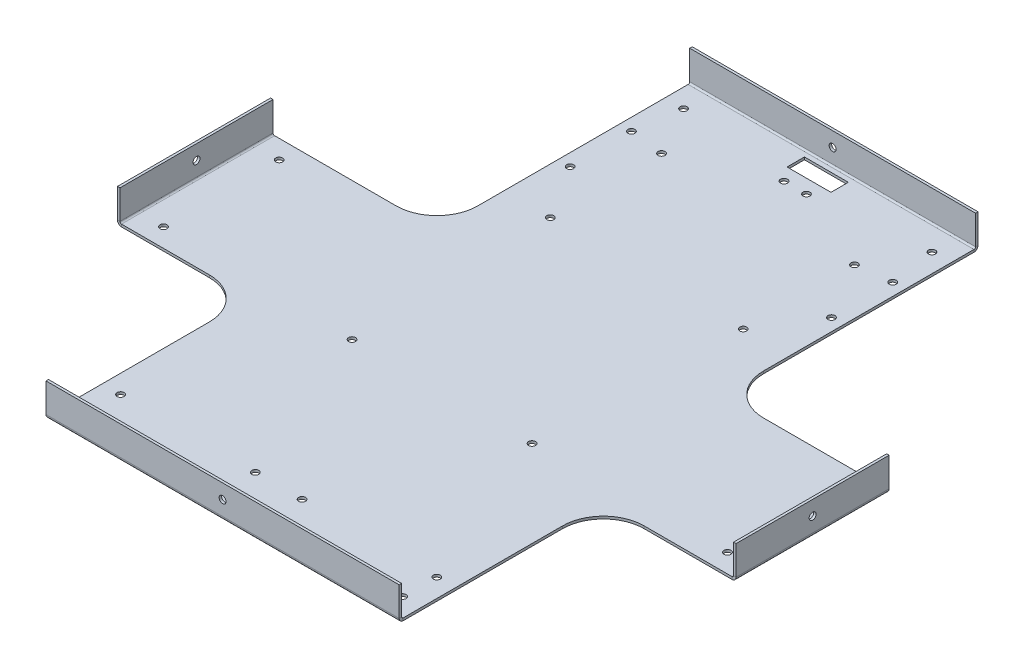
from build123d import *

# Parameters (mm, degrees)
BASE_FLANGE1_DEPTH            = 1.21
M3_CLEARANCE_HOLE2_AT_2_COUNT = 2
M3_CLEARANCE_HOLE2_AT_2_PITCH = 66
M3_CLEARANCE_HOLE2_AT_3_COUNT = 2
M3_CLEARANCE_HOLE2_AT_3_PITCH = 86.678897774
FILLET1_R                     = 20
SKETCH62_W                    = 21.5
SKETCH62_H                    = 8.5
QRD_CLEARANCE_DEPTH           = 10
QRD_HOLES_D                   = 3.4
QRD_HOLES_DEPTH               = 1.27
QRD_HOLES_TIP                 = 1.021463052
M3_STEERING_BOX_D             = 3.4
M3_STEERING_BOX_DEPTH         = 3
M3_STEERING_BOX_TIP           = 1.021463052
EDGE_FLANGE1_STRIP_W          = 6.364
EDGE_FLANGE1_STRIP_H          = 1.21
EDGE_FLANGE1_STRIP_CUT_DEPTH  = 173
EDGE_FLANGE1_DEPTH            = 173
EDGE_FLANGE2_STRIP_W          = 6.364
EDGE_FLANGE2_STRIP_H          = 1.21
EDGE_FLANGE2_STRIP_CUT_DEPTH  = 140
EDGE_FLANGE2_DEPTH            = 140
EDGE_FLANGE3_STRIP_W          = 6.364
EDGE_FLANGE3_STRIP_H          = 1.21
EDGE_FLANGE3_STRIP_CUT_DEPTH  = 75
EDGE_FLANGE3_DEPTH            = 75
M3_CLEARANCE_HOLE3_D          = 3.4
M3_CLEARANCE_HOLE4_D          = 3.4
M3_CLEARANCE_HOLE5_D          = 3.4
M3_CLEARANCE_HOLE5_DEPTH      = 1.21
M3_CLEARANCE_HOLE6_D          = 3.4
M3_CLEARANCE_HOLE7_D          = 3.4
M3_CLEARANCE_HOLE7_DEPTH      = 1.21
M3_CLEARANCE_HOLE7_TIP        = 1.021463052
M3_CLEARANCE_HOLE8_D          = 3.4
M3_CLEARANCE_HOLE9_D          = 3.4
M3_CLEARANCE_HOLE10_D         = 3.4
M3_CLEARANCE_HOLE11_D         = 3.4


# Sheet-metal steps are written as plain solids
with BuildPart() as part:
    # Sketch1 → Base-Flange1 (new body)
    with BuildSketch(Plane(origin=(0, 0, 0), x_dir=(1, 0, 0), z_dir=(0, 1, 0))):
        Polygon((0, 0), (173, 0), (173, 100), (238, 100), (238, 175), (156.5, 175), (156.5, 300), (16.5, 300), (16.5, 175), (-65, 175), (-65, 100), (0, 100), align=None)
    extrude(amount=-BASE_FLANGE1_DEPTH)

    # Sketch28 → M3 Clearance Hole2 (revolve, cut)
    with BuildSketch(Plane(origin=(9.052, -1.21, -27.479586063), x_dir=(0, 0, -1), z_dir=(1, 0, 0))):
        Polygon((0, 0), (0, 2.291463052), (1.7, 1.27), (1.7, 0), align=None)
    m3_clearance_hole2 = revolve(axis=Axis((9.052, -7.56, -27.479586063), (0, 1, 0)), mode=Mode.SUBTRACT)

    # M3 Clearance Hole2 at 2: M3 Clearance Hole2 ×2
    with Locations(*[(i * M3_CLEARANCE_HOLE2_AT_2_PITCH, 0, 0) for i in range(1, M3_CLEARANCE_HOLE2_AT_2_COUNT)]):
        add(m3_clearance_hole2, mode=Mode.SUBTRACT)

    # M3 Clearance Hole2 at 3: M3 Clearance Hole2 ×2
    with Locations(*[Vector(0.38492784467456836, 0, -0.9229466693120418) * (i * M3_CLEARANCE_HOLE2_AT_3_PITCH) for i in range(1, M3_CLEARANCE_HOLE2_AT_3_COUNT)]):
        add(m3_clearance_hole2, mode=Mode.SUBTRACT)

    # Mirror3: M3 Clearance Hole2 across plane
    add(m3_clearance_hole2.mirror(Plane(origin=(86.5, 0, 0), x_dir=(0, 0, 1), z_dir=(1, 0, 0))), mode=Mode.SUBTRACT)

    # Mirror3 copy 1 sketch → Mirror3 copy 1 (revolve, cut)
    with BuildSketch(Plane(origin=(97.948, -1.21, -27.479586063), x_dir=(0, 0, -1), z_dir=(-1, 0, 0))):
        Polygon((0, 0), (0, -2.291463052), (1.7, -1.27), (1.7, 0), align=None)
    revolve(axis=Axis((97.948, -7.56, -27.479586063), (0, -1, 0)), mode=Mode.SUBTRACT)

    # Mirror3 copy 2 sketch → Mirror3 copy 2 (revolve, cut)
    with BuildSketch(Plane(origin=(130.582878701, -1.21, -107.479586063), x_dir=(0, 0, -1), z_dir=(-1, 0, 0))):
        Polygon((0, 0), (0, -2.291463052), (1.7, -1.27), (1.7, 0), align=None)
    revolve(axis=Axis((130.582878701, -7.56, -107.479586063), (0, -1, 0)), mode=Mode.SUBTRACT)

    # Fillet1
    fillet1_edges = [part.edges().sort_by_distance(p)[0] for p in [
        (0, -0.605, -100),
        (16.5, -0.605, -175),
        (156.5, -0.605, -175),
        (173, -0.605, -100),
    ]]
    fillet(fillet1_edges, radius=FILLET1_R)

    # Sketch62 → QRD Clearance (cut)
    with BuildSketch(Plane(origin=(0, 0, 0), x_dir=(1, 0, 0), z_dir=(0, 1, 0))):
        with Locations((86.5, 291.488)):
            Rectangle(SKETCH62_W, SKETCH62_H)
    extrude(amount=-QRD_CLEARANCE_DEPTH, mode=Mode.SUBTRACT)

    # QRD Holes
    with Locations(Plane(origin=(0, 0, 0), x_dir=(1, 0, 0), z_dir=(0, 1, 0))):
        with Locations((92, 280.488), (81, 280.488)):
            Hole(QRD_HOLES_D / 2, depth=QRD_HOLES_DEPTH)
            with Locations((0, 0, -(QRD_HOLES_DEPTH + QRD_HOLES_TIP / 2))):  # 118° drill point
                Cone(0, QRD_HOLES_D / 2, QRD_HOLES_TIP, mode=Mode.SUBTRACT)

    # M3 (Steering Box)
    with Locations(Plane(origin=(0, 0, 0), x_dir=(1, 0, 0), z_dir=(0, 1, 0))):
        with Locations((39.262, 262.238), (39.262, 207.762), (133.738, 207.762), (133.738, 262.238)):
            Hole(M3_STEERING_BOX_D / 2, depth=M3_STEERING_BOX_DEPTH)
            with Locations((0, 0, -(M3_STEERING_BOX_DEPTH + M3_STEERING_BOX_TIP / 2))):  # 118° drill point
                Cone(0, M3_STEERING_BOX_D / 2, M3_STEERING_BOX_TIP, mode=Mode.SUBTRACT)

    # Edge-Flange1 strip (across the edge) → Edge-Flange1 strip cut (cut)
    with BuildSketch(Plane(origin=(0, 0, 0), x_dir=(0, 0, -1), z_dir=(1, 0, 0))):
        with Locations((-1.21, -0.605)):
            Rectangle(EDGE_FLANGE1_STRIP_W, EDGE_FLANGE1_STRIP_H)
    extrude(amount=EDGE_FLANGE1_STRIP_CUT_DEPTH, mode=Mode.SUBTRACT)

    # Edge-Flange1 section (across the edge) → Edge-Flange1 (add)
    with BuildSketch(Plane(origin=(0, 0, 0), x_dir=(0, 0, -1), z_dir=(1, 0, 0))):
        with BuildLine():
            Line((0, 0.762), (0, 15))
            Line((0, 15), (1.21, 15))
            Line((1.21, 15), (1.21, 0.762))
            ThreePointArc((1.21, 0.762), (1.433184633, 0.223184633), (1.972, 0))
            Line((1.972, 0), (1.972, -1.21))
            ThreePointArc((1.972, -1.21), (0.577585428, -0.632414572), (0, 0.762))
        make_face()
    extrude(amount=EDGE_FLANGE1_DEPTH)

    # Edge-Flange2 strip (across the edge) → Edge-Flange2 strip cut (cut)
    with BuildSketch(Plane(origin=(156.5, 0, -300), x_dir=(0, 0, 1), z_dir=(-1, 0, 0))):
        with Locations((-1.21, -0.605)):
            Rectangle(EDGE_FLANGE2_STRIP_W, EDGE_FLANGE2_STRIP_H)
    extrude(amount=EDGE_FLANGE2_STRIP_CUT_DEPTH, mode=Mode.SUBTRACT)

    # Edge-Flange2 section (across the edge) → Edge-Flange2 (add)
    with BuildSketch(Plane(origin=(156.5, 0, -300), x_dir=(0, 0, 1), z_dir=(-1, 0, 0))):
        with BuildLine():
            Line((0, 0.762), (0, 15))
            Line((0, 15), (1.21, 15))
            Line((1.21, 15), (1.21, 0.762))
            ThreePointArc((1.21, 0.762), (1.433184633, 0.223184633), (1.972, 0))
            Line((1.972, 0), (1.972, -1.21))
            ThreePointArc((1.972, -1.21), (0.577585428, -0.632414572), (0, 0.762))
        make_face()
    extrude(amount=EDGE_FLANGE2_DEPTH)

    # Edge-Flange3 strip (across the edge) → Edge-Flange3 strip cut (cut)
    with BuildSketch(Plane(origin=(238, 0, -100), x_dir=(-1, 0, 0), z_dir=(0, 0, -1))):
        with Locations((-1.21, -0.605)):
            Rectangle(EDGE_FLANGE3_STRIP_W, EDGE_FLANGE3_STRIP_H)
    edge_flange3_strip_cut = extrude(amount=EDGE_FLANGE3_STRIP_CUT_DEPTH, mode=Mode.SUBTRACT)

    # Edge-Flange3 section (across the edge) → Edge-Flange3 (add)
    with BuildSketch(Plane(origin=(238, 0, -100), x_dir=(-1, 0, 0), z_dir=(0, 0, -1))):
        with BuildLine():
            Line((0, 0.762), (0, 15))
            Line((0, 15), (1.21, 15))
            Line((1.21, 15), (1.21, 0.762))
            ThreePointArc((1.21, 0.762), (1.433184633, 0.223184633), (1.972, 0))
            Line((1.972, 0), (1.972, -1.21))
            ThreePointArc((1.972, -1.21), (0.577585428, -0.632414572), (0, 0.762))
        make_face()
    edge_flange3 = extrude(amount=EDGE_FLANGE3_DEPTH)

    # Mirror4: Edge-Flange3 strip cut, Edge-Flange3 across plane
    add(edge_flange3_strip_cut.mirror(Plane(origin=(86.5, 0, 0), x_dir=(0, 0, 1), z_dir=(1, 0, 0))), mode=Mode.SUBTRACT)
    add(edge_flange3.mirror(Plane(origin=(86.5, 0, 0), x_dir=(0, 0, 1), z_dir=(1, 0, 0))))

    # M3 Clearance Hole3 (through all)
    with Locations(Plane(origin=(50.766060613, 0, -139.899791502), x_dir=(1, 0, 0), z_dir=(0, 1, 0))):
        with Locations((-28.266060613, 124.338208498), (-28.266060613, 94.338208498)):
            Hole(M3_CLEARANCE_HOLE3_D / 2)

    # M3 Clearance Hole4 (through all)
    with Locations(Plane(origin=(50.766060613, 0, -139.899791502), x_dir=(1, 0, 0), z_dir=(0, 1, 0))):
        with Locations((99.733939387, 124.338208498), (99.733939387, 94.338208498)):
            Hole(M3_CLEARANCE_HOLE4_D / 2)

    # M3 Clearance Hole5
    with Locations(Plane.XY):
        with Locations((86.5, 7.881)):
            Hole(M3_CLEARANCE_HOLE5_D / 2, depth=M3_CLEARANCE_HOLE5_DEPTH)

    # M3 Clearance Hole6 (through all)
    with Locations(Plane(origin=(238, 0, 0), x_dir=(0, 0, -1), z_dir=(1, 0, 0))):
        with Locations((137.5, 7.881)):
            Hole(M3_CLEARANCE_HOLE6_D / 2)

    # M3 Clearance Hole7
    with Locations(Plane(origin=(0, 0, -300), x_dir=(-1, 0, 0), z_dir=(0, 0, -1))):
        with Locations((-86.5, 7.881)):
            Hole(M3_CLEARANCE_HOLE7_D / 2, depth=M3_CLEARANCE_HOLE7_DEPTH)
            with Locations((0, 0, -(M3_CLEARANCE_HOLE7_DEPTH + M3_CLEARANCE_HOLE7_TIP / 2))):  # 118° drill point
                Cone(0, M3_CLEARANCE_HOLE7_D / 2, M3_CLEARANCE_HOLE7_TIP, mode=Mode.SUBTRACT)

    # M3 Clearance Hole8 (through all)
    with Locations(Plane(origin=(50.766060613, 0, -139.899791502), x_dir=(1, 0, 0), z_dir=(0, 1, 0))):
        with Locations((-25.095060613, 146.719208498), (96.562939387, 146.719208498)):
            Hole(M3_CLEARANCE_HOLE8_D / 2)

    # M3 Clearance Hole9 (through all)
    with Locations(Plane(origin=(50.766060613, 0, -139.899791502), x_dir=(1, 0, 0), z_dir=(0, 1, 0))):
        with Locations((-102.385060613, -30.728791502), (-102.385060613, 25.929208498)):
            Hole(M3_CLEARANCE_HOLE9_D / 2)

    # M3 Clearance Hole10 (through all)
    with Locations(Plane(origin=(50.766060613, 0, -139.899791502), x_dir=(1, 0, 0), z_dir=(0, 1, 0))):
        with Locations((173.852939387, 25.929208498), (173.852939387, -30.728791502)):
            Hole(M3_CLEARANCE_HOLE10_D / 2)

    # M3 Clearance Hole11 (through all)
    with Locations(Plane(origin=(50.766060613, 0, -139.899791502), x_dir=(1, 0, 0), z_dir=(0, 1, 0))):
        with Locations((113.062939387, -129.018791502), (-41.595060613, -129.018791502)):
            Hole(M3_CLEARANCE_HOLE11_D / 2)


solid = part.part
